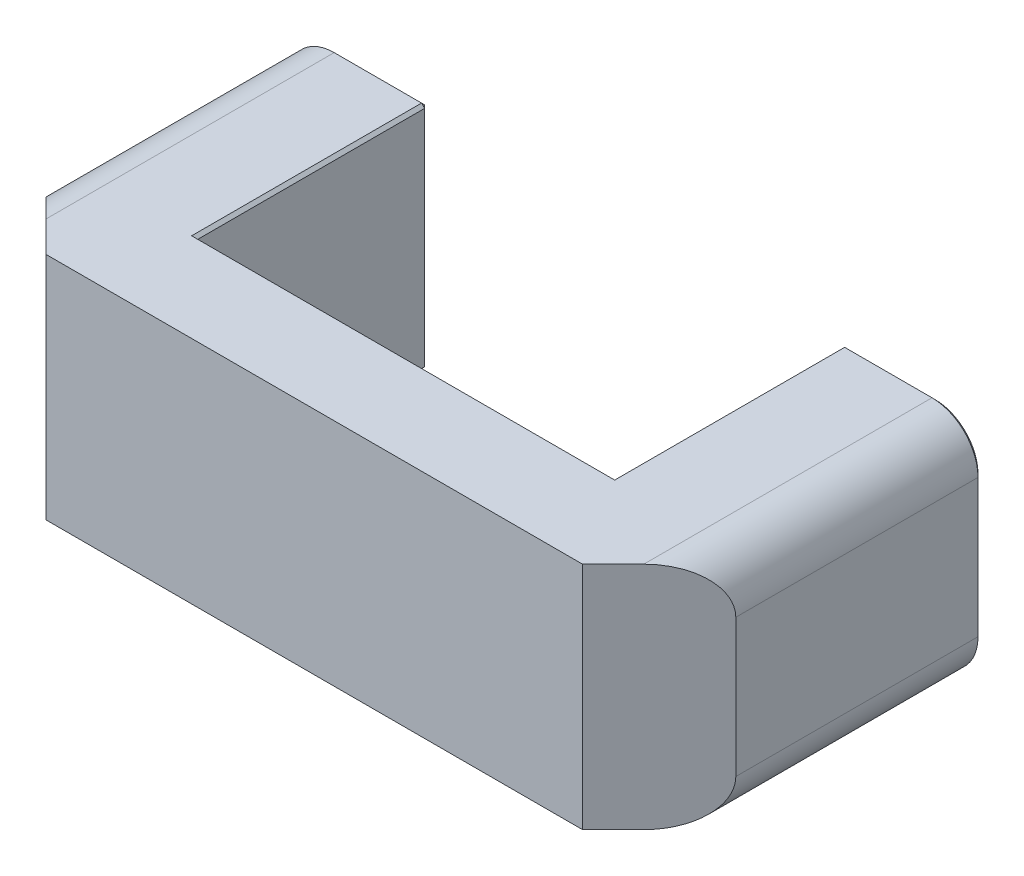
from build123d import *

# Parameters (mm, degrees)
BOSS_EXTRUDE1_DEPTH       = 30
CHAMFER1_SIZE             = 10
FILLET1_R                 = 6
F_5_0MM_DOWEL_HOLE1_D     = 5
F_5_0MM_DOWEL_HOLE1_DEPTH = 12
F_5_0MM_DOWEL_HOLE1_TIP   = 1.502151548
CHAMFER2_SIZE             = 0.4


with BuildPart() as part:
    # Sketch1 → Boss-Extrude1 (new body)
    with BuildSketch(Plane(origin=(0, 0, 0), x_dir=(1, 0, 0), z_dir=(0, 1, 0))):
        Polygon((-45, 30), (-45, -12), (45, -12), (45, 30), (27.2, 30), (27.2, 0), (-27.2, 0), (-27.2, 30), align=None)
    extrude(amount=BOSS_EXTRUDE1_DEPTH)

    # Chamfer1
    chamfer1_edges = [part.edges().sort_by_distance(p)[0] for p in [
        (-45, 15, 12),
        (45, 15, 12),
    ]]
    chamfer(chamfer1_edges, length=CHAMFER1_SIZE)

    # Fillet1
    fillet1_edges = [part.edges().sort_by_distance(p)[0] for p in [
        (-45, 30, -14),
        (-45, 0, -14),
        (45, 30, -14),
        (45, 0, -14),
    ]]
    fillet(fillet1_edges, radius=FILLET1_R)

    # Ø5.0mm Dowel Hole1
    with Locations(Plane(origin=(0, 0, -30), x_dir=(-1, 0, 0), z_dir=(0, 0, -1))):
        with Locations((-36.1, 7.5), (36.1, 22.5), (36.1, 7.5), (-36.1, 22.5)):
            Hole(F_5_0MM_DOWEL_HOLE1_D / 2, depth=F_5_0MM_DOWEL_HOLE1_DEPTH)
            with Locations((0, 0, -(F_5_0MM_DOWEL_HOLE1_DEPTH + F_5_0MM_DOWEL_HOLE1_TIP / 2))):  # 118° drill point
                Cone(0, F_5_0MM_DOWEL_HOLE1_D / 2, F_5_0MM_DOWEL_HOLE1_TIP, mode=Mode.SUBTRACT)

    # Chamfer2
    chamfer2_edges = [part.edges().sort_by_distance(p)[0] for p in [
        (33.1, 0, -30),
        (-33.1, 30, -30),
        (43.242640687, 1.757359313, -30),
        (-43.242640687, 28.242640687, -30),
        (45, 15, -30),
        (-45, 15, -30),
        (43.242640687, 28.242640687, -30),
        (-43.242640687, 1.757359313, -30),
        (33.1, 30, -30),
        (-27.2, 30, -15),
        (-33.1, 0, -30),
        (-27.2, 15, -30),
        (-27.2, 0, -15),
        (0, 0, 0),
        (0, 30, 0),
        (27.2, 30, -15),
        (27.2, 15, -30),
        (27.2, 0, -15),
        (-38.6, 7.5, -30),
        (-38.6, 22.5, -30),
        (33.6, 7.5, -30),
        (33.6, 22.5, -30),
    ]]
    chamfer(chamfer2_edges, length=CHAMFER2_SIZE)


solid = part.part
